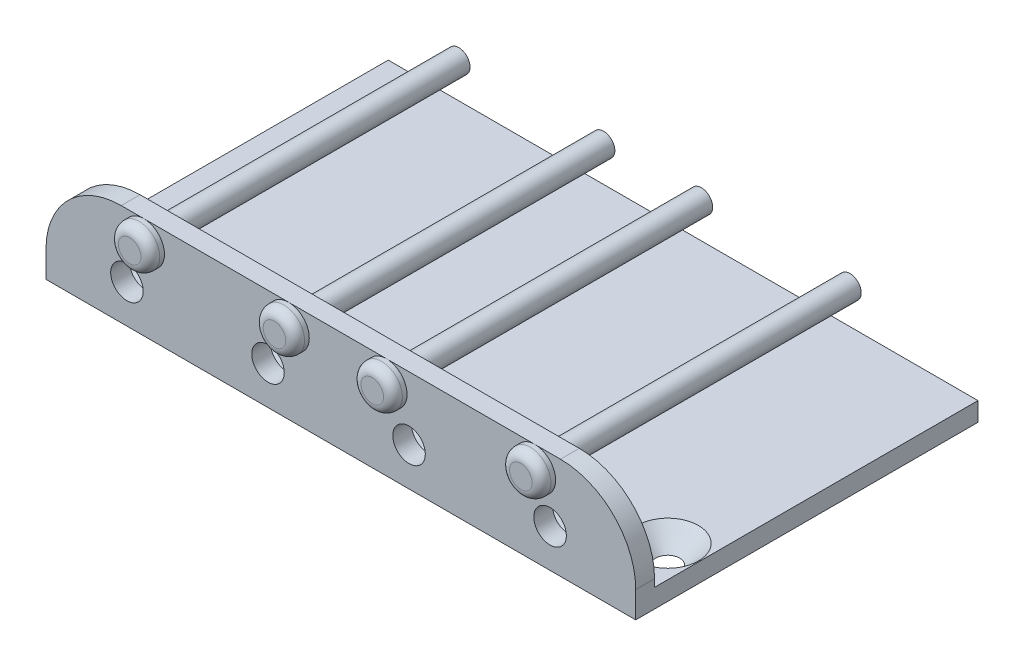
from build123d import *

# Parameters (mm, degrees)
SKETCH1_W           = 79.6544
SKETCH1_H           = 46.228
BOSS_EXTRUDE1_DEPTH = 2.54
SKETCH2_W           = 2.54
SKETCH2_H           = 11.176
BOSS_EXTRUDE2_DEPTH = 79.6544
SKETCH3_R           = 2.1971
CUT_EXTRUDE1_DEPTH  = 94.112727805
SKETCH4_R           = 2.794
BOSS_EXTRUDE3_DEPTH = 1.905
FILLET1_R           = 10.16
FILLET2_R           = 1.27
SKETCH5_R           = 1.524
BOSS_EXTRUDE4_DEPTH = 40.005
SKETCH6_R           = 1.60655
CUT_EXTRUDE2_DEPTH  = 2.54
CHAMFER1_SIZE       = 2.54


with BuildPart() as part:
    # Sketch1 → Boss-Extrude1 (new body)
    with BuildSketch(Plane(origin=(0, 0, 0), x_dir=(1, 0, 0), z_dir=(0, 1, 0))):
        with Locations((39.8272, 23.114)):
            Rectangle(SKETCH1_W, SKETCH1_H)
    extrude(amount=BOSS_EXTRUDE1_DEPTH)

    # Sketch2 → Boss-Extrude2 (add)
    with BuildSketch(Plane(origin=(79.6544, 0, 0), x_dir=(0, 0, -1), z_dir=(1, 0, 0))):
        with Locations((1.27, 8.128)):
            Rectangle(SKETCH2_W, SKETCH2_H)
    extrude(amount=-BOSS_EXTRUDE2_DEPTH)

    # Sketch3 → Cut-Extrude1 (cut, through all)
    with BuildSketch(Plane.XY):
        with Locations((10.9347, 5.1689)):
            Circle(SKETCH3_R)
        with Locations((29.9847, 5.1689)):
            Circle(SKETCH3_R)
        with Locations((49.0347, 5.1689)):
            Circle(SKETCH3_R)
        with Locations((68.0847, 5.1689)):
            Circle(SKETCH3_R)
    extrude(amount=-CUT_EXTRUDE1_DEPTH, mode=Mode.SUBTRACT)

    # Sketch4 → Boss-Extrude3 (add)
    with BuildSketch(Plane.XY):
        with Locations(Location((13.208, 10.922, 0), (0, 0, 90))):
            Circle(SKETCH4_R)
        with Locations(Location((32.766, 10.922, 0), (0, 0, 90))):
            Circle(SKETCH4_R)
        with Locations(Location((45.974, 10.922, 0), (0, 0, 90))):
            Circle(SKETCH4_R)
        with Locations(Location((66.04, 10.922, 0), (0, 0, 90))):
            Circle(SKETCH4_R)
    extrude(amount=BOSS_EXTRUDE3_DEPTH)

    # Fillet1
    fillet1_edges = [part.edges().sort_by_distance(p)[0] for p in [
        (79.6544, 13.716, -1.27),
        (0, 13.716, -1.27),
    ]]
    fillet(fillet1_edges, radius=FILLET1_R)

    # Fillet2
    fillet2_edges = [part.edges().sort_by_distance(p)[0] for p in [
        (13.208, 8.128, 1.905),
        (32.766, 8.128, 1.905),
        (45.974, 8.128, 1.905),
        (66.04, 8.128, 1.905),
    ]]
    fillet(fillet2_edges, radius=FILLET2_R)

    # Sketch5 → Boss-Extrude4 (add)
    with BuildSketch(Plane(origin=(0, 0, -2.54), x_dir=(-1, 0, 0), z_dir=(0, 0, -1))):
        with Locations(Location((-66.04, 10.922, 0), (0, 0, 180))):
            Circle(SKETCH5_R)
        with Locations(Location((-45.974, 10.922, 0), (0, 0, 180))):
            Circle(SKETCH5_R)
        with Locations(Location((-32.766, 10.922, 0), (0, 0, 180))):
            Circle(SKETCH5_R)
        with Locations(Location((-13.208, 10.922, 0), (0, 0, 180))):
            Circle(SKETCH5_R)
    extrude(amount=BOSS_EXTRUDE4_DEPTH)

    # Sketch6 → Cut-Extrude2 (cut)
    with BuildSketch(Plane.XZ):
        with BuildLine():
            ThreePointArc((41.43375, -8.59155), (40.963202399, -7.455547601), (39.8272, -6.985))
            Line((39.8272, -6.985), (39.8272, -8.59155))
            Line((39.8272, -8.59155), (38.22065, -8.59155))
            ThreePointArc((38.22065, -8.59155), (39.8272, -10.1981), (41.43375, -8.59155))
        make_face()
        with BuildLine():
            Line((39.8272, -8.59155), (39.8272, -6.985))
            ThreePointArc((39.8272, -6.985), (38.691197601, -7.455547601), (38.22065, -8.59155))
            Line((38.22065, -8.59155), (39.8272, -8.59155))
        make_face()
        with Locations(Location((57.6072, -8.59155, 0), (0, 0, 270))):
            Circle(SKETCH6_R)
        with Locations(Location((22.0472, -8.59155, 0), (0, 0, 270))):
            Circle(SKETCH6_R)
        with Locations(Location((4.2672, -8.59155, 0), (0, 0, 270))):
            Circle(SKETCH6_R)
        with Locations(Location((75.3872, -8.59155, 0), (0, 0, 270))):
            Circle(SKETCH6_R)
    extrude(amount=-CUT_EXTRUDE2_DEPTH, mode=Mode.SUBTRACT)

    # Chamfer1
    chamfer1_edges = [part.edges().sort_by_distance(p)[0] for p in [
        (57.6072, 2.54, -6.985),
        (22.0472, 2.54, -6.985),
        (4.2672, 2.54, -6.985),
        (75.3872, 2.54, -6.985),
        (38.22065, 2.54, -8.59155),
    ]]
    chamfer(chamfer1_edges, length=CHAMFER1_SIZE - 0.0001)  # a hair under: the kernel refuses the full size


solid = part.part
